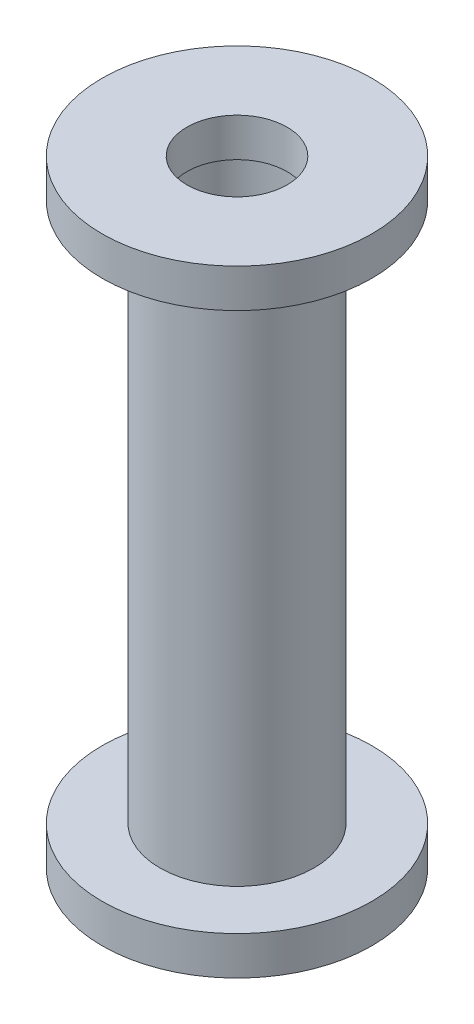
from build123d import *

# Parameters (mm, degrees)
SKETCH1_R           = 7
BOSS_EXTRUDE1_DEPTH = 2
SKETCH2_R           = 4
BOSS_EXTRUDE2_DEPTH = 28
SKETCH3_R           = 2.75
CUT_EXTRUDE1_DEPTH  = 32.591137998
SKETCH6_R           = 7
BOSS_EXTRUDE4_DEPTH = 2
SKETCH7_R           = 2.6
CUT_EXTRUDE2_DEPTH  = 2


with BuildPart() as part:
    # Sketch1 → Boss-Extrude1 (new body)
    with BuildSketch(Plane(origin=(0, 0, 0), x_dir=(1, 0, 0), z_dir=(0, 1, 0))):
        Circle(SKETCH1_R)
    extrude(amount=BOSS_EXTRUDE1_DEPTH)

    # Sketch2 → Boss-Extrude2 (add)
    with BuildSketch(Plane(origin=(0, 2, 0), x_dir=(1, 0, 0), z_dir=(0, 1, 0))):
        Circle(SKETCH2_R)
    extrude(amount=BOSS_EXTRUDE2_DEPTH)

    # Sketch3 → Cut-Extrude1 (cut, through all)
    with BuildSketch(Plane(origin=(0, 30, 0), x_dir=(1, 0, 0), z_dir=(0, 1, 0))):
        Circle(SKETCH3_R)
    extrude(amount=-CUT_EXTRUDE1_DEPTH, mode=Mode.SUBTRACT)

    # Sketch6 → Boss-Extrude4 (add)
    with BuildSketch(Plane(origin=(0, 30, 0), x_dir=(1, 0, 0), z_dir=(0, 1, 0))):
        Circle(SKETCH6_R)
    extrude(amount=BOSS_EXTRUDE4_DEPTH)

    # Sketch7 → Cut-Extrude2 (cut)
    with BuildSketch(Plane(origin=(0, 32, 0), x_dir=(1, 0, 0), z_dir=(0, 1, 0))):
        Circle(SKETCH7_R)
    extrude(amount=-CUT_EXTRUDE2_DEPTH, mode=Mode.SUBTRACT)


solid = part.part
